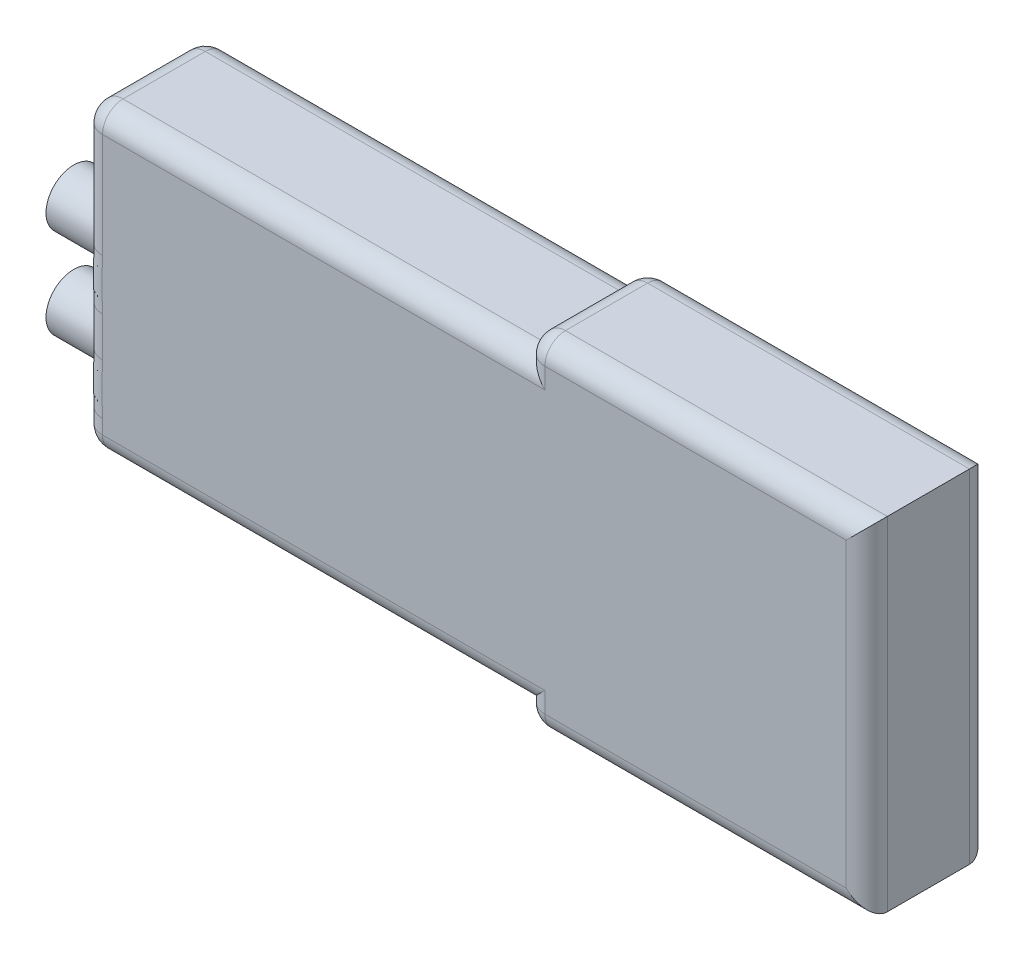
from build123d import *

# Parameters (mm, degrees)
SKETCH1_W           = 8.33160893
SKETCH1_H           = 8.33160893
BOSS_EXTRUDE1_DEPTH = 3
SKETCH2_W           = 3
SKETCH2_H           = 7.33160893
BOSS_EXTRUDE2_DEPTH = 10.76210758
SKETCH3_R           = 0.675
BOSS_EXTRUDE3_DEPTH = 1.7
FILLET2_R           = 0.5
FILLET3_R           = 0.5
FILLET4_R           = 0.5


with BuildPart() as part:
    # Sketch1 → Boss-Extrude1 (new body)
    with BuildSketch(Plane.XY):
        Rectangle(SKETCH1_W, SKETCH1_H)
    extrude(amount=BOSS_EXTRUDE1_DEPTH)

    # Sketch2 → Boss-Extrude2 (add)
    with BuildSketch(Plane.ZY.offset(4.165804465)):
        with Locations((1.5, 0)):
            Rectangle(SKETCH2_W, SKETCH2_H)
    extrude(amount=BOSS_EXTRUDE2_DEPTH)

    # Sketch3 → Boss-Extrude3 (add)
    with BuildSketch(Plane.ZY.offset(14.927912045)):
        with Locations((1.5, 0)):
            Circle(SKETCH3_R)
        with Locations((1.5, -2.2)):
            Circle(SKETCH3_R)
    extrude(amount=BOSS_EXTRUDE3_DEPTH)

    # Fillet2
    # the kernel refuses this fillet: 0.5 mm, written as the material it adds along each edge
    with BuildSketch(Plane(origin=(-14.927912045, 0, 1.5), x_dir=(0, 0, 1), z_dir=(0, -1, 0))) as fillet2_piece_1:
        with BuildLine():
            CenterArc((0.675 + FILLET2_R, FILLET2_R), FILLET2_R, 180, 90)
            Line((0.675, FILLET2_R), (0.675, 0))
            Line((0.675, 0), (0.675 + FILLET2_R, 0))
        make_face()
    revolve(axis=Axis((-14.927912045, 0, 1.5), (-1, 0, 0)))
    with BuildSketch(Plane(origin=(-14.927912045, -2.2, 1.5), x_dir=(0, 0, 1), z_dir=(0, -1, 0))) as fillet2_piece_2:
        with BuildLine():
            CenterArc((0.675 + FILLET2_R, FILLET2_R), FILLET2_R, 180, 90)
            Line((0.675, FILLET2_R), (0.675, 0))
            Line((0.675, 0), (0.675 + FILLET2_R, 0))
        make_face()
    revolve(axis=Axis((-14.927912045, -2.2, 1.5), (-1, 0, 0)))

    # Fillet3
    fillet3_edges = [part.edges().sort_by_distance(p)[0] for p in [
        (-14.927912045, 0, 3),
        (-14.927912045, 0, 0),
        (-9.546858255, -3.665804465, 3),
        (-9.546858255, -3.665804465, 0),
        (-9.546858255, 3.665804465, 0),
        (-9.546858255, 3.665804465, 3),
        (-14.927912045, -3.665804465, 1.5),
        (-14.927912045, 3.665804465, 1.5),
        (0, 4.165804465, 3),
        (4.165804465, 0, 3),
        (0, -4.165804465, 3),
        (-4.165804465, -3.915804465, 3),
        (-4.165804465, 3.915804465, 3),
        (4.165804465, 0, 0),
        (0, -4.165804465, 0),
        (-4.165804465, -3.915804465, 0),
        (0, 4.165804465, 0),
        (-4.165804465, 3.915804465, 0),
    ]]
    fillet(fillet3_edges, radius=FILLET3_R)

    # Fillet4
    # the kernel refuses this fillet: 0.5 mm, written as the material it takes off along each edge
    with BuildSketch(Plane(origin=(-3.665804465, -3.665804465, 2.5), x_dir=(0, -1, 0), z_dir=(-1, 0, 0))) as fillet4_piece_1_section:
        Polygon((0, 0), (FILLET4_R, 0), (FILLET4_R, FILLET4_R), (0, FILLET4_R), align=None)
    fillet4_piece_1 = extrude(amount=FILLET4_R, mode=Mode.PRIVATE)
    fillet4_piece_1 = fillet4_piece_1 - Plane(origin=(-3.665804465, -3.665804465, 2.5), x_dir=(0, 0.7071067811865475, -0.7071067811865475), z_dir=(-1, 0, 0)) * Sphere(FILLET4_R, mode=Mode.PRIVATE)
    add(fillet4_piece_1, mode=Mode.SUBTRACT)
    with BuildSketch(Plane(origin=(-3.665804465, -3.665804465, 0.5), x_dir=(0, -1, 0), z_dir=(-1, 0, 0))) as fillet4_piece_2_section:
        Polygon((0, 0), (FILLET4_R, 0), (FILLET4_R, -FILLET4_R), (0, -FILLET4_R), align=None)
    fillet4_piece_2 = extrude(amount=FILLET4_R, mode=Mode.PRIVATE)
    fillet4_piece_2 = fillet4_piece_2 - Plane(origin=(-3.665804465, -3.665804465, 0.5), x_dir=(0, 0.7071067811865475, 0.7071067811865475), z_dir=(-1, 0, 0)) * Sphere(FILLET4_R, mode=Mode.PRIVATE)
    add(fillet4_piece_2, mode=Mode.SUBTRACT)
    with BuildSketch(Plane(origin=(-3.665804465, 3.665804465, 2.5), x_dir=(0, 1, 0), z_dir=(-1, 0, 0))) as fillet4_piece_3_section:
        Polygon((0, 0), (FILLET4_R, 0), (FILLET4_R, -FILLET4_R), (0, -FILLET4_R), align=None)
    fillet4_piece_3 = extrude(amount=FILLET4_R, mode=Mode.PRIVATE)
    fillet4_piece_3 = fillet4_piece_3 - Plane(origin=(-3.665804465, 3.665804465, 2.5), x_dir=(0, -0.7071067811865475, -0.7071067811865475), z_dir=(-1, 0, 0)) * Sphere(FILLET4_R, mode=Mode.PRIVATE)
    add(fillet4_piece_3, mode=Mode.SUBTRACT)
    with BuildSketch(Plane(origin=(-3.665804465, 3.665804465, 0.5), x_dir=(0, 1, 0), z_dir=(-1, 0, 0))) as fillet4_piece_4_section:
        Polygon((0, 0), (FILLET4_R, 0), (FILLET4_R, FILLET4_R), (0, FILLET4_R), align=None)
    fillet4_piece_4 = extrude(amount=FILLET4_R, mode=Mode.PRIVATE)
    fillet4_piece_4 = fillet4_piece_4 - Plane(origin=(-3.665804465, 3.665804465, 0.5), x_dir=(0, -0.7071067811865475, 0.7071067811865475), z_dir=(-1, 0, 0)) * Sphere(FILLET4_R, mode=Mode.PRIVATE)
    add(fillet4_piece_4, mode=Mode.SUBTRACT)
    with BuildSketch(Plane(origin=(-4.165804465, -4.165804465, 0.5), x_dir=(0, 1, 0), z_dir=(0, 0, 1))) as fillet4_piece_5:
        with BuildLine():
            CenterArc((FILLET4_R, -FILLET4_R), FILLET4_R, 90, 90)
            Line((0, -FILLET4_R), (0, 0))
            Line((0, 0), (FILLET4_R, 0))
        make_face()
    extrude(amount=2, mode=Mode.SUBTRACT)
    with BuildSketch(Plane(origin=(-4.165804465, 4.165804465, 0.5), x_dir=(0, -1, 0), z_dir=(0, 0, 1))) as fillet4_piece_6:
        with BuildLine():
            CenterArc((FILLET4_R, FILLET4_R), FILLET4_R, 180, 90)
            Line((0, FILLET4_R), (0, 0))
            Line((0, 0), (FILLET4_R, 0))
        make_face()
    extrude(amount=2, mode=Mode.SUBTRACT)


solid = part.part
